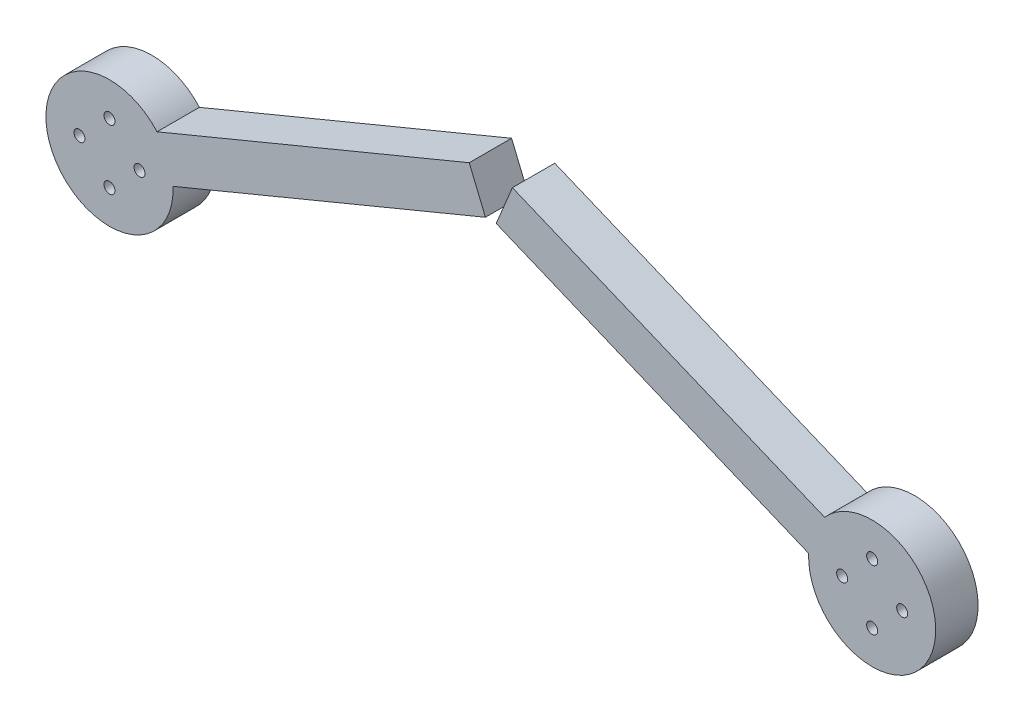
from build123d import *

# Parameters (mm, degrees)
BOSS_EXTRUDE1_DEPTH     = 25.4
BOSS_EXTRUDE1_2_DEPTH   = 25.4
SKETCH3_W               = 3.3
SKETCH3_H               = 25.4
CIRPATTERN1_COUNT       = 4
MIRROR3_COPY_1_SKETCH_W = 3.3
MIRROR3_COPY_1_SKETCH_H = 25.4
MIRROR3_COPY_2_SKETCH_W = 3.3
MIRROR3_COPY_2_SKETCH_H = 25.4
MIRROR3_COPY_3_SKETCH_W = 3.3
MIRROR3_COPY_3_SKETCH_H = 25.4
MIRROR3_COPY_4_SKETCH_W = 3.3
MIRROR3_COPY_4_SKETCH_H = 25.4


with BuildPart() as part:
    # Sketch1 → Boss-Extrude1 (new body)
    with BuildSketch(Plane.XY):
        with BuildLine():
            Line((-190.53968393, -113.859619178), (-3.221755471, -36.269992735))
            Line((-3.221755471, -36.269992735), (-12.941914653, -12.803452609))
            Line((-12.941914653, -12.803452609), (-200.090704327, -90.323019474))
            ThreePointArc((-200.090704327, -90.323019474), (-263.903982542, -129.92426569), (-190.53968393, -113.859619178))
        make_face()
    extrude(amount=BOSS_EXTRUDE1_DEPTH)

    # Sketch3 → M6 Clearance Hole1 (revolve, cut)
    with BuildSketch(Plane(origin=(-228.6, -97.598107272, 0), x_dir=(0, 1, 0), z_dir=(1, 0, 0))):
        with Locations((1.65, 12.7)):
            Rectangle(SKETCH3_W, SKETCH3_H)
    m6_clearance_hole1 = revolve(axis=Axis((-228.6, -97.598107272, -6.35), (0, 0, 1)), mode=Mode.SUBTRACT)

    # CirPattern1: M6 Clearance Hole1 ×4 about axis
    cirpattern1_axis = Axis((-228.6, -115.598107213, 25.4), (0, 0, -1))
    for i in range(1, CIRPATTERN1_COUNT):
        add(m6_clearance_hole1.rotate(cirpattern1_axis, i * 360 / CIRPATTERN1_COUNT), mode=Mode.SUBTRACT)


with BuildPart() as body_2:
    # Sketch1 → Boss-Extrude1 2 (new body)
    with BuildSketch(Plane.XY):
        with BuildLine():
            Line((200.090704327, -90.323019474), (12.941914653, -12.803452609))
            Line((12.941914653, -12.803452609), (3.221755471, -36.269992735))
            Line((3.221755471, -36.269992735), (190.53968393, -113.859619178))
            ThreePointArc((190.53968393, -113.859619178), (263.903982542, -129.92426569), (200.090704327, -90.323019474))
        make_face()
    extrude(amount=BOSS_EXTRUDE1_2_DEPTH)

    # Mirror3 copy 1 sketch → Mirror3 copy 1 (revolve, cut)
    with BuildSketch(Plane(origin=(210.600000059, -115.598107213, 0), x_dir=(-1, 0, 0), z_dir=(0, -1, 0))):
        with Locations((1.65, -12.7)):
            Rectangle(MIRROR3_COPY_1_SKETCH_W, MIRROR3_COPY_1_SKETCH_H)
    revolve(axis=Axis((210.600000059, -115.598107213, -6.35), (0, 0, -1)), mode=Mode.SUBTRACT)

    # Mirror3 copy 2 sketch → Mirror3 copy 2 (revolve, cut)
    with BuildSketch(Plane(origin=(228.6, -133.598107154, 0), x_dir=(0, -1, 0), z_dir=(1, 0, 0))):
        with Locations((1.65, -12.7)):
            Rectangle(MIRROR3_COPY_2_SKETCH_W, MIRROR3_COPY_2_SKETCH_H)
    revolve(axis=Axis((228.6, -133.598107154, -6.35), (0, 0, -1)), mode=Mode.SUBTRACT)

    # Mirror3 copy 3 sketch → Mirror3 copy 3 (revolve, cut)
    with BuildSketch(Plane(origin=(246.599999941, -115.598107213, 0), x_dir=(1, 0, 0), z_dir=(0, 1, 0))):
        with Locations((1.65, -12.7)):
            Rectangle(MIRROR3_COPY_3_SKETCH_W, MIRROR3_COPY_3_SKETCH_H)
    revolve(axis=Axis((246.599999941, -115.598107213, -6.35), (0, 0, -1)), mode=Mode.SUBTRACT)

    # Mirror3 copy 4 sketch → Mirror3 copy 4 (revolve, cut)
    with BuildSketch(Plane(origin=(228.6, -97.598107272, 0), x_dir=(0, 1, 0), z_dir=(-1, 0, 0))):
        with Locations((1.65, -12.7)):
            Rectangle(MIRROR3_COPY_4_SKETCH_W, MIRROR3_COPY_4_SKETCH_H)
    revolve(axis=Axis((228.6, -97.598107272, -6.35), (0, 0, -1)), mode=Mode.SUBTRACT)


solid = Compound([part.part, body_2.part])
